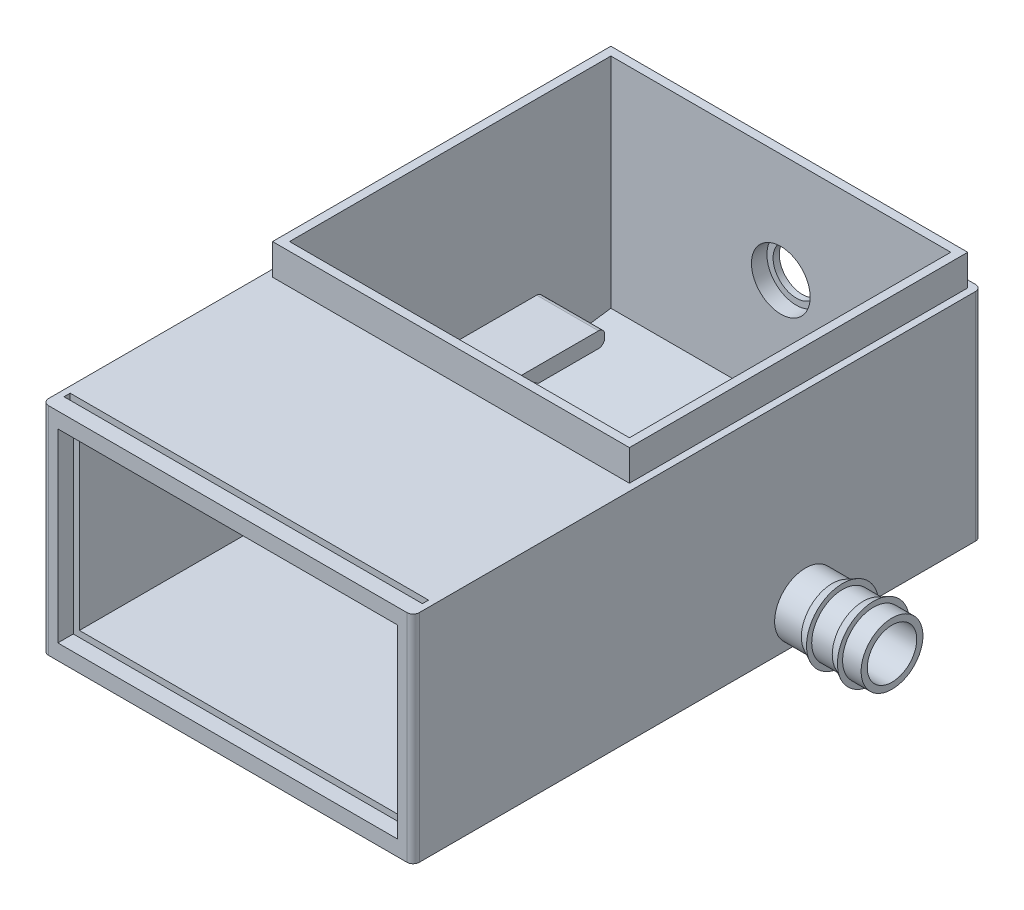
from build123d import *
from build123d.topology import SkipClean

# Parameters (mm, degrees)
CROQUIS2_W                     = 120
CROQUIS2_H                     = 114
SALIENTE_EXTRUIR1_DEPTH        = 10
CORTAR_EXTRUIR1_DEPTH          = 134.225372959
CORTAR_EXTRUIR1_DEPTH_BACK     = 134.225372959
CROQUIS5_W                     = 120
CROQUIS5_H                     = 114
CROQUIS5_W_2                   = 110
CROQUIS5_H_2                   = 104
SALIENTE_EXTRUIR5_DEPTH        = 80
CROQUIS6_R                     = 8
CORTAR_EXTRUIR2_DEPTH          = 10
SALIENTE_EXTRUIR6_START        = 8
CROQUIS7_R                     = 10
CROQUIS7_R_2                   = 8
SALIENTE_EXTRUIR6_DEPTH        = 8
CROQUIS9_R                     = 7.5
CORTAR_EXTRUIR4_DEPTH          = 155.983870128
CROQUIS10_R                    = 9.5
CROQUIS10_R_2                  = 7.5
CORTAR_EXTRUIR5_DEPTH          = 8
SALIENTE_EXTRUIR7_DEPTH        = 20
CROQUIS13_W                    = 120
CROQUIS13_H                    = 114
CROQUIS13_W_2                  = 115.5
CROQUIS13_H_2                  = 109.5
CORTAR_EXTRUIR6_DEPTH          = 10
CROQUIS14_R                    = 1.5
SALIENTE_EXTRUIR8_DEPTH        = 2
CROQUIS15_R                    = 0.75
CORTAR_EXTRUIR7_DEPTH          = 5
CROQUIS16_W                    = 120
CROQUIS16_H                    = 70
CROQUIS16_W_2                  = 110
CROQUIS16_H_2                  = 60
SALIENTE_EXTRUIR9_DEPTH        = 70
CROQUIS17_W                    = 116
CROQUIS17_H                    = 2
CORTAR_EXTRUIR8_DEPTH          = 68
REDONDEO1_R                    = 2
REDONDEO2_R                    = 2
CROQUIS19_R                    = 12.5
CROQUIS19_R_2                  = 7.5
SALIENTE_EXTRUIR11_DEPTH       = 2
CROQUIS21_W                    = 0.990232649
CROQUIS21_H                    = 0.145037793
CORTAR_EXTRUIR9_DEPTH          = 2
SALIENTE_EXTRUIR14_OUTLINE_R   = 10
SALIENTE_EXTRUIR14_OUTLINE_R_2 = 8
SALIENTE_EXTRUIR14_DEPTH       = 10
CROQUIS30_R                    = 10
CROQUIS30_R_2                  = 8
SALIENTE_EXTRUIR15_DEPTH       = 10
CORTAR_EXTRUIR10_DEPTH         = 2


# Read off the part's stored shape, not the designer's step: Recubrir-Lámina1, Saliente-Extruir14, Recubrir-Lámina8
with BuildPart() as part:
    # Croquis2 → Saliente-Extruir1 (new body)
    with BuildSketch(Plane(origin=(0, 0, 0), x_dir=(1, 0, 0), z_dir=(0, 1, 0))):
        Rectangle(CROQUIS2_W, CROQUIS2_H)
    extrude(amount=SALIENTE_EXTRUIR1_DEPTH)

    # Croquis3 → Cortar-Extruir1 (cut, two sides: drawn at the far end of the back side and taken through both)
    with BuildSketch(Plane.ZY.offset(60).offset(-CORTAR_EXTRUIR1_DEPTH_BACK)):
        Polygon((-293.556980837, 43.200979767), (-57, 10), (0, 2), (57, 10), (293.556980837, 43.200979767), (293.556980837, 520.952003796), (-293.556980837, 520.952003796), align=None)
    extrude(amount=CORTAR_EXTRUIR1_DEPTH + CORTAR_EXTRUIR1_DEPTH_BACK, mode=Mode.SUBTRACT)

    # Croquis5 → Saliente-Extruir5 (add)
    with BuildSketch(Plane.XZ):
        Rectangle(CROQUIS5_W, CROQUIS5_H)
        Rectangle(CROQUIS5_W_2, CROQUIS5_H_2, mode=Mode.SUBTRACT)
    extrude(amount=-SALIENTE_EXTRUIR5_DEPTH)

    # Croquis6 → Cortar-Extruir2 (cut)
    with BuildSketch(Plane(origin=(60, 0, 0), x_dir=(0, 0, -1), z_dir=(1, 0, 0))):
        with Locations((0, 10)):
            Circle(CROQUIS6_R)
    extrude(amount=-CORTAR_EXTRUIR2_DEPTH, mode=Mode.SUBTRACT)

    # Croquis7 → Saliente-Extruir6 (add)
    with BuildSketch(Plane(origin=(60, 0, 0), x_dir=(0, 0, -1), z_dir=(1, 0, 0)).offset(SALIENTE_EXTRUIR6_START)):
        with Locations(Location((0, 10, 0), (0, 0, 270))):
            Circle(CROQUIS7_R)
        with Locations((0, 10)):
            Circle(CROQUIS7_R_2, mode=Mode.SUBTRACT)
    extrude(amount=-SALIENTE_EXTRUIR6_DEPTH)

    # Croquis9 → Cortar-Extruir4 (cut, through all)
    with BuildSketch(Plane.XY.offset(57)):
        with Locations((0, 44.649122807)):
            Circle(CROQUIS9_R)
    extrude(amount=-CORTAR_EXTRUIR4_DEPTH, mode=Mode.SUBTRACT)

    # Croquis10 → Cortar-Extruir5 (cut)
    with BuildSketch(Plane.XY.offset(-52)):
        with Locations((0, 44.649122807)):
            Circle(CROQUIS10_R)
        with Locations((0, 44.649122807)):
            Circle(CROQUIS10_R_2, mode=Mode.SUBTRACT)
    cortar_extruir5 = extrude(amount=-CORTAR_EXTRUIR5_DEPTH, mode=Mode.SUBTRACT)

    # Simetría1: Cortar-Extruir5 across plane
    add(cortar_extruir5.mirror(Plane.XY), mode=Mode.SUBTRACT)

    # Croquis11 → Saliente-Extruir7 (add)
    with BuildSketch(Plane.ZY.offset(-55)):
        with BuildLine():
            Line((30, 21.97965363), (30, 22.97965363))
            ThreePointArc((30, 22.97965363), (29.414213562, 24.393867193), (28, 24.97965363))
            Line((28, 24.97965363), (-28, 24.97965363))
            ThreePointArc((-28, 24.97965363), (-29.414213562, 24.393867193), (-30, 22.97965363))
            Line((-30, 22.97965363), (-30, 21.97965363))
            ThreePointArc((-30, 21.97965363), (-29.414213562, 20.565440068), (-28, 19.97965363))
            Line((-28, 19.97965363), (-8.460817995, 19.97965363))
            ThreePointArc((-8.460817995, 19.97965363), (0, 23.083536514), (8.460817995, 19.97965363))
            Line((8.460817995, 19.97965363), (28, 19.97965363))
            ThreePointArc((28, 19.97965363), (29.414213562, 20.565440068), (30, 21.97965363))
        make_face()
    saliente_extruir7 = extrude(amount=SALIENTE_EXTRUIR7_DEPTH)

    # Simetría2: Saliente-Extruir7 across plane
    add(saliente_extruir7.mirror(Plane(origin=(0, 0, 0), x_dir=(0, 0, 1), z_dir=(1, 0, 0))))

    # Croquis13 → Cortar-Extruir6 (cut)
    with BuildSketch(Plane(origin=(0, 80, 0), x_dir=(1, 0, 0), z_dir=(0, 1, 0))):
        Rectangle(CROQUIS13_W, CROQUIS13_H)
        Rectangle(CROQUIS13_W_2, CROQUIS13_H_2, mode=Mode.SUBTRACT)
    extrude(amount=-CORTAR_EXTRUIR6_DEPTH, mode=Mode.SUBTRACT)

    # Croquis14 → Saliente-Extruir8 (add)
    with BuildSketch(Plane.XY.offset(57)):
        with Locations(Location((-45, 60, 0), (0, 0, 180))):
            Circle(CROQUIS14_R)
        with Locations(Location((-45, 10, 0), (0, 0, 180))):
            Circle(CROQUIS14_R)
        with Locations(Location((45, 10, 0), (0, 0, 180))):
            Circle(CROQUIS14_R)
        with Locations(Location((45, 60, 0), (0, 0, 180))):
            Circle(CROQUIS14_R)
    extrude(amount=SALIENTE_EXTRUIR8_DEPTH)

    # Croquis15 → Cortar-Extruir7 (cut)
    with BuildSketch(Plane.XY.offset(59)):
        with Locations((-45, 60)):
            Circle(CROQUIS15_R)
        with Locations((-45, 10)):
            Circle(CROQUIS15_R)
        with Locations((45, 10)):
            Circle(CROQUIS15_R)
        with Locations((45, 60)):
            Circle(CROQUIS15_R)
    extrude(amount=-CORTAR_EXTRUIR7_DEPTH, mode=Mode.SUBTRACT)

    # Croquis16 → Saliente-Extruir9 (add)
    with BuildSketch(Plane.XY.offset(57)):
        with Locations((0, 35)):
            Rectangle(CROQUIS16_W, CROQUIS16_H)
        with Locations((0, 35)):
            Rectangle(CROQUIS16_W_2, CROQUIS16_H_2, mode=Mode.SUBTRACT)
    extrude(amount=SALIENTE_EXTRUIR9_DEPTH)

    # Croquis17 → Cortar-Extruir8 (cut)
    with BuildSketch(Plane(origin=(0, 70, 0), x_dir=(1, 0, 0), z_dir=(0, 1, 0))):
        with Locations((0, -121)):
            Rectangle(CROQUIS17_W, CROQUIS17_H)
    extrude(amount=-CORTAR_EXTRUIR8_DEPTH, mode=Mode.SUBTRACT)

    # Redondeo1
    redondeo1_edges = [part.edges().sort_by_distance(p)[0] for p in [
        (-60, 35, -57),
        (60, 35, -57),
    ]]
    fillet(redondeo1_edges, radius=REDONDEO1_R)

    # Redondeo2
    redondeo2_edges = [part.edges().sort_by_distance(p)[0] for p in [
        (-60, 35, 127),
        (60, 35, 127),
    ]]
    fillet(redondeo2_edges, radius=REDONDEO2_R)

    # Croquis19 → Saliente-Extruir11 (add)
    with BuildSketch(Plane(origin=(0, 0, -57), x_dir=(-1, 0, 0), z_dir=(0, 0, -1))):
        with Locations(Location((0, 44.649122807, 0), (0, 0, 180))):
            Circle(CROQUIS19_R)
        with Locations((0, 44.649122807)):
            Circle(CROQUIS19_R_2, mode=Mode.SUBTRACT)
    saliente_extruir11 = extrude(amount=SALIENTE_EXTRUIR11_DEPTH)

    # Simetría3: Saliente-Extruir11 across plane
    add(saliente_extruir11.mirror(Plane.XY))

    # Croquis21 → Cortar-Extruir9 (cut)
    # profile 1 of 2: a face of its own
    with BuildSketch(Plane(origin=(0, 0, -57), x_dir=(-1, 0, 0), z_dir=(0, 0, -1))):
        Polygon((-30.738084473, 27.587250959), (-32.242943607, 26.052942527), (-33.747557331, 24.518388684), (-33.967445423, 24.518388684), (-33.950512077, 24.743184993), (-33.938486947, 24.907119419), (-33.931370033, 24.959146512), (-33.920817368, 24.995467313), (-33.905111076, 25.01853593), (-33.882042459, 25.031297293), (-33.849893642, 25.036941742), (-33.806455927, 25.038168796), (-33.750011439, 25.037923385), (-33.669025869, 25.039886671), (-33.637122463, 25.042831601), (-33.60939104, 25.047248996), (-33.584113726, 25.053875088), (-33.560308877, 25.062955288), (-33.536504027, 25.074735008), (-33.511717535, 25.089705067), (-33.484476934, 25.108110879), (-33.355881666, 25.241614364), (-33.316125113, 25.321127469), (-33.293056496, 25.40554879), (-33.286921226, 25.49266963), (-33.297473891, 25.57979047), (-33.325450724, 25.663966381), (-33.370851725, 25.742743253), (-33.433676895, 25.81366698), (-33.564726271, 25.900296998), (-33.635895409, 25.925574313), (-33.708782421, 25.938335675), (-33.782160256, 25.938826497), (-33.854556447, 25.927292188), (-33.924743941, 25.903241928), (-33.991004862, 25.867166538), (-34.052112155, 25.818575196), (-34.105120892, 25.767775157), (-34.230771231, 25.881400365), (-34.41065736, 26.01195892), (-34.520110585, 26.072329982), (-34.641343529, 26.12901988), (-34.774110781, 26.181537795), (-34.917185288, 26.229883727), (-35.070567049, 26.273321441), (-35.233274421, 26.31185094), (-35.404571172, 26.345226811), (-35.653417741, 26.386210417), (-35.653417741, 26.548181557), (-37.368348535, 26.548181557), (-37.368348535, 26.490264604), (-37.371293465, 26.461060717), (-37.375465449, 26.450508052), (-37.382336952, 26.442164084), (-37.392153384, 26.435292581), (-37.405650979, 26.430138954), (-37.423075147, 26.425476148), (-37.445162121, 26.421549575), (-37.472402722, 26.417623002), (-37.525656869, 26.410506088), (-37.562959314, 26.405597872), (-37.605906207, 26.399708012), (-37.653025084, 26.393327331), (-37.703579712, 26.386455828), (-37.756343038, 26.379093504), (-37.810088007, 26.37197659), (-37.863587565, 26.364614265), (-37.99709105, 26.34792633), (-38.06605149, 26.341791059), (-38.136975216, 26.336637432), (-38.209616818, 26.33295627), (-38.284221707, 26.330256751), (-38.360789882, 26.328538875), (-38.439566754, 26.328048054), (-38.520552324, 26.328293464), (-38.890141016, 26.335655789), (-38.890141016, 26.101043047), (-39.035178809, 26.021529942), (-39.16745524, 25.935881567), (-39.232734517, 25.885081528), (-39.296050508, 25.830600326), (-39.355685337, 25.773665016), (-39.41065736, 25.715502653), (-39.459248702, 25.657340289), (-39.500477719, 25.600159568), (-39.532626536, 25.545432956), (-39.60281403, 25.412420293), (-39.953015267, 25.412420293), (-39.953015267, 25.074244186), (-39.747606413, 25.074244186), (-39.669074951, 25.072771721), (-39.636435312, 25.071053845), (-39.608458479, 25.068599737), (-39.585144451, 25.065654807), (-39.566493229, 25.061973645), (-39.553241045, 25.057801661), (-39.545142488, 25.052893445), (-39.542442969, 25.047739818), (-39.539988861, 25.012155249), (-39.537043931, 24.977061502), (-39.533362769, 24.931905912), (-39.528699963, 24.878160943), (-39.523300925, 24.817053649), (-39.517411066, 24.750056496), (-39.510784974, 24.678151126), (-39.50366806, 24.603055416), (-39.49164293, 24.452618585), (-39.486489303, 24.382921912), (-39.482071908, 24.318133457), (-39.478390746, 24.260216504), (-39.475691227, 24.210398108), (-39.474218762, 24.169905323), (-39.47372794, 24.139965203), (-39.474709583, 24.122295624), (-39.52158305, 24.139719792), (-39.58784397, 24.198372978), (-39.69263439, 24.300218467), (-39.843071221, 24.452618585), (-40.0467622, 24.662935655), (-40.311315061, 24.938777415), (-40.643846719, 25.287751597), (-41.051964909, 25.716975118), (-41.603648427, 26.298353345), (-41.854949104, 26.563151617), (-42.083181165, 26.80414504), (-42.283927214, 27.015934576), (-42.452033624, 27.193612008), (-42.583083001, 27.332023709), (-42.671921717, 27.426261463), (-42.713886966, 27.471171643), (-42.805670612, 27.572771721), (-42.798308288, 27.364908758), (-42.791191374, 27.157045796), (-41.105219056, 25.378799011), (-39.419246739, 23.600306815), (-39.225863014, 21.372467412), (-39.035178809, 19.144628008), (-39.090641654, 19.086465645), (-39.217273636, 18.955416268), (-39.35347664, 18.815777513), (-39.531154072, 18.634173508), (-39.745643126, 18.415267058), (-39.991299355, 18.164457203), (-40.263459952, 17.886897568), (-40.556725879, 17.58749637), (-40.865943509, 17.271898059), (-41.464009672, 16.661070533), (-41.731507463, 16.387192061), (-41.971764654, 16.141045011), (-42.179136795, 15.92778301), (-42.349206491, 15.752559686), (-42.476574706, 15.620283255), (-42.556333221, 15.536352756), (-42.583328411, 15.505676403), (-42.576702319, 15.49561456), (-42.568849173, 15.487516003), (-42.558541919, 15.477208749), (-42.546025967, 15.465429029), (-42.53179214, 15.452176845), (-42.516085847, 15.437697607), (-42.499397912, 15.422482136), (-42.481973744, 15.406530433), (-42.380619076, 15.319655004), (-40.70421778, 17.032622511), (-40.119158391, 17.626762101), (-39.856814227, 17.891805784), (-39.62072902, 18.129118045), (-39.416301809, 18.333545256), (-39.248195399, 18.500670023), (-39.121318006, 18.625093307), (-39.040577847, 18.701906893), (-39.010883138, 18.726447975), (-39.000821295, 18.670003487), (-38.99345897, 18.608650783), (-38.984624181, 18.528401445), (-38.974807748, 18.431464172), (-38.964009672, 18.320047661), (-38.952720774, 18.19660602), (-38.940941055, 18.063102535), (-38.928915925, 17.921991315), (-38.866090756, 17.136676698), (-38.793449154, 17.07139742), (-38.755165066, 17.033358744), (-38.742649114, 17.014952932), (-38.733568914, 16.99335678), (-38.727433644, 16.965870769), (-38.723752481, 16.930531611), (-38.721789195, 16.884394377), (-38.721298373, 16.825004959), (-38.721052962, 16.749909249), (-38.721052962, 16.496399875), (-38.06899642, 16.496399875), (-38.06899642, 17.027959706), (-35.655871849, 17.027959706), (-35.583475658, 16.923905519), (-35.511570288, 16.830649408), (-35.472059147, 16.788438748), (-35.429848486, 16.748927606), (-35.384692896, 16.711870573), (-35.336592375, 16.677022236), (-35.284810693, 16.644137187), (-35.229593259, 16.612970013), (-35.170449252, 16.583275304), (-35.087009574, 16.545482038), (-35.051670416, 16.532720676), (-35.016576669, 16.523149654), (-34.979765046, 16.516523562), (-34.938045207, 16.512106167), (-34.889453865, 16.509652059), (-34.83080068, 16.508670415), (-34.759631543, 16.508425005), (-34.629072988, 16.509652059), (-34.580236235, 16.512351578), (-34.538761807, 16.516768972), (-34.501950184, 16.523640475), (-34.467347259, 16.533456908), (-34.432008101, 16.546709092), (-34.393478603, 16.563887849), (-34.349059245, 16.585729412), (-34.193714197, 16.678494701), (-34.123035882, 16.733712135), (-34.057756604, 16.793837786), (-33.998121776, 16.858871652), (-33.944867628, 16.928322914), (-33.897748751, 17.001700748), (-33.857746788, 17.078514334), (-33.824861738, 17.15827285), (-33.811854965, 17.203673851), (-33.805474284, 17.232632328), (-33.799093602, 17.264535734), (-33.792958332, 17.298402427), (-33.787313883, 17.333741585), (-33.782405667, 17.369326153), (-33.777988272, 17.404665311), (-33.77430711, 17.438532004), (-33.757373763, 17.622344706), (-32.766895703, 16.57591298), (-32.416203645, 16.206324288), (-32.255214148, 16.036745413), (-32.107722247, 15.881645776), (-31.977163692, 15.744461129), (-31.866728824, 15.628381812), (-31.778871751, 15.536843577), (-31.717273636, 15.473036765), (-31.684879408, 15.440397126), (-31.59554987, 15.351067588), (-31.4964039, 15.44751404), (-31.399957448, 15.54666001), (-32.829720872, 17.054464074), (-33.334285514, 17.586760138), (-33.565707915, 17.83069849), (-33.77725204, 18.053531513), (-33.964500493, 18.25084181), (-34.122790471, 18.417475756), (-34.247949988, 18.549015954), (-34.335316239, 18.6407996), (-34.380471829, 18.687918477), (-34.50366806, 18.813568815), (-34.303167422, 20.959195595), (-34.23347075, 21.712606805), (-34.201321933, 22.055200306), (-34.172363456, 22.366135813), (-34.14659532, 22.639032642), (-34.124753757, 22.867510113), (-34.107820411, 23.044942134), (-34.096286103, 23.164948024), (-34.090641654, 23.220901691), (-34.076162416, 23.334526899), (-33.286430404, 23.334526899), (-33.286430404, 23.924003683), (-33.287412047, 24.18119422), (-33.288884512, 24.278622315), (-33.291338621, 24.357644598), (-33.29428355, 24.419488124), (-33.298210123, 24.465870769), (-33.302872929, 24.498019586), (-33.308517378, 24.517407041), (-33.315388881, 24.525751008), (-33.250109603, 24.605754935), (-33.165442871, 24.698274813), (-33.050345198, 24.820734811), (-32.908497745, 24.969699178), (-32.742845443, 25.141732161), (-32.557314865, 25.333398009), (-32.35485094, 25.54077015), (-32.138889421, 25.760412832), (-31.712365419, 26.195771623), (-31.516527587, 26.395536028), (-31.337868512, 26.578612499), (-31.179578534, 26.74107446), (-31.045584228, 26.878749929), (-30.939812165, 26.988203153), (-30.865698098, 27.06526215), (-30.827414011, 27.106245757), (-30.723605235, 27.222325073), (-30.730722149, 27.403438257), align=None)
        Polygon((-34.583181165, 17.963220332), (-34.547105775, 17.948495683), (-34.393233192, 17.834625064), (-34.336788704, 17.76468298), (-34.294578043, 17.687623984), (-34.267337443, 17.605165949), (-34.255066902, 17.51853593), (-34.258748064, 17.429206393), (-34.27862634, 17.33840439), (-34.315192552, 17.247847798), (-34.379981008, 17.144775255), (-34.416792631, 17.103791648), (-34.457285415, 17.069434134), (-34.502195595, 17.04121189), (-34.552013991, 17.018879505), (-34.607231425, 17.00219157), (-34.668093308, 16.990902672), (-34.735581283, 16.98427658), (-34.80994076, 16.981822472), (-34.841107934, 16.982558704), (-34.869330178, 16.984767402), (-34.895343725, 16.988693975), (-34.919884807, 16.994338424), (-34.943689656, 17.001700748), (-34.967249095, 17.01127177), (-34.991544766, 17.023051489), (-35.194744923, 17.205146316), (-35.249962357, 17.321716455), (-35.274503438, 17.44638515), (-35.26885899, 17.573017132), (-35.233274421, 17.694986308), (-35.168240554, 17.805666587), (-35.0740028, 17.898922698), (-34.950561159, 17.967883138), (-34.869821, 17.987516003), (-34.822456712, 17.991687987), (-34.772392905, 17.99266963), (-34.721838277, 17.989970111), (-34.672265292, 17.984080252), (-34.625391826, 17.975245462), align=None, mode=Mode.SUBTRACT)
        Polygon((-36.041657655, 20.03350599), (-35.861280704, 19.842821785), (-35.302725682, 19.252363357), (-35.123575786, 19.058488811), (-34.998661679, 18.916395948), (-34.919148574, 18.814059637), (-34.87595627, 18.740190981), (-34.859513746, 18.682519439), (-34.8607408, 18.629510702), (-34.870802643, 18.569385052), (-34.880864487, 18.522511586), (-34.887981401, 18.505578239), (-34.898043244, 18.492080644), (-34.912031661, 18.480791747), (-34.930928294, 18.470729903), (-34.956205608, 18.461158881), (-34.989090657, 18.450851627), (-35.030319675, 18.439071908), (-35.283338228, 18.329127861), (-35.392791453, 18.251578043), (-35.489483315, 18.161021451), (-35.572432171, 18.058194318), (-35.640410968, 17.945059932), (-35.692683472, 17.822354523), (-35.727777219, 17.691795968), (-35.745201387, 17.554611321), (-35.757226517, 17.366135813), (-38.527914649, 17.366135813), (-38.537485671, 17.421844068), (-38.560554288, 17.639523463), (-38.578960099, 17.844686907), (-38.599820018, 18.084453276), (-38.62117076, 18.336735597), (-38.641049036, 18.578956074), (-38.657491561, 18.789518555), (-38.668535047, 18.946090657), (-38.672707031, 19.026094584), (-38.651601701, 19.084502358), (-38.617735008, 19.131866646), (-38.562026752, 19.198372978), (-38.479568718, 19.289665802), (-38.365452687, 19.410898746), (-38.214525035, 19.567716258), (-38.022368364, 19.765517377), (-37.783829049, 20.009701141), (-37.474366008, 20.324317809), (-37.334972664, 20.464938208), (-37.209813147, 20.591079368), (-37.101096155, 20.700041771), (-37.011275795, 20.788880487), (-36.943296999, 20.855386819), (-36.899613873, 20.897106658), (-36.882925938, 20.910849664), (-36.813720087, 20.842625456), (-36.73666109, 20.76286694), (-36.635061012, 20.657094878), (-36.51161937, 20.528008788), (-36.369771918, 20.379044422), (-36.212218173, 20.213146709), align=None, mode=Mode.SUBTRACT)
        Polygon((-38.14703706, 22.255700945), (-37.832174981, 21.923414697), (-37.080972468, 21.128283648), (-37.89500015, 20.297077208), (-38.178204234, 20.008228676), (-38.305327037, 19.879878818), (-38.419688478, 19.765762788), (-38.518589038, 19.667843872), (-38.599820018, 19.588330767), (-38.660927312, 19.529922992), (-38.699947632, 19.494829245), (-38.713936049, 19.485258223), (-38.75639212, 19.953011242), (-38.799339013, 20.440397126), (-38.849893642, 21.017603369), (-38.902656967, 21.625485965), (-38.952966185, 22.204655494), (-38.995176846, 22.695967952), (-39.024135322, 23.039788507), (-39.035178809, 23.177463976), (-39.003029992, 23.151450429), (-38.953947828, 23.102613676), (-38.875416367, 23.021628107), (-38.761300336, 22.90260386), (-38.605709878, 22.739160255), (-38.403000543, 22.525652844), align=None, mode=Mode.SUBTRACT)
        Polygon((-38.890386427, 25.583471633), (-38.890141016, 25.557458086), (-38.890141016, 25.412420293), (-39.047203939, 25.412420293), (-39.102175962, 25.413647347), (-39.126471633, 25.414874401), (-39.148558607, 25.416592277), (-39.16745524, 25.418800974), (-39.182916121, 25.421500493), (-39.19445043, 25.424445423), (-39.201567343, 25.427881174), (-39.204266862, 25.431807747), (-39.173835921, 25.485798127), (-39.141196282, 25.523591393), (-39.100948908, 25.564084178), (-39.056774961, 25.604331552), (-39.012110192, 25.641388586), (-38.969899531, 25.672310349), (-38.933824141, 25.69366109), (-38.907074362, 25.702495879), (-38.900939092, 25.693415679), (-38.898484984, 25.682617603), (-38.896030875, 25.668383776), (-38.894067589, 25.650714197), (-38.892349713, 25.63059051), (-38.891122659, 25.608012714), align=None, mode=Mode.SUBTRACT)
        Polygon((-34.439615837, 23.27759159), (-34.443296999, 23.213539366), (-34.492379162, 22.665782421), (-34.541461326, 22.132013892), (-34.599132868, 21.507443361), (-34.659503929, 20.854159765), (-34.717175471, 20.234252039), (-34.766257635, 19.7093183), (-34.80086056, 19.341692895), (-34.815339798, 19.19297394), (-34.859268335, 19.219478308), (-34.914240358, 19.269542115), (-34.992280998, 19.345128647), (-35.093635666, 19.446728725), (-35.219531415, 19.575323994), (-35.370459068, 19.731650684), (-35.546909446, 19.91644503), (-35.750109603, 20.130443263), (-36.073561061, 20.473527586), (-36.218108033, 20.627400169), (-36.347439533, 20.76581187), (-36.459101455, 20.886063171), (-36.550148869, 20.98496373), (-36.618373076, 21.05981403), (-36.661074558, 21.107669139), (-36.675308386, 21.126074951), (-36.605120892, 21.20092525), (-36.52339909, 21.286082804), (-36.414682097, 21.398726369), (-36.282160256, 21.535420195), (-36.129023906, 21.69321935), (-35.958217977, 21.868442674), (-35.772932809, 22.058390647), (-35.576113333, 22.259136696), (-34.965531219, 22.879535243), (-34.765521402, 23.078563416), (-34.622937717, 23.213784777), (-34.528699963, 23.293543293), (-34.472991708, 23.325446699), (-34.446487339, 23.317593553), align=None, mode=Mode.SUBTRACT)
        Polygon((-34.271754837, 25.049948515), (-34.288688184, 24.827851725), (-34.301449546, 24.668825515), (-34.307830227, 24.615571368), (-34.315437963, 24.576551048), (-34.324763574, 24.549555858), (-34.337279526, 24.532622511), (-34.353231229, 24.5232969), (-34.373845737, 24.519370327), (-34.399859284, 24.518388684), (-34.469801367, 24.518388684), (-34.469801367, 23.781419998), (-35.291191374, 22.960029991), (-35.291191374, 23.334526899), (-37.416694466, 23.334526899), (-37.416694466, 22.657929275), (-36.50842903, 22.657929275), (-36.187186269, 22.65645681), (-36.045829638, 22.654984345), (-35.920424711, 22.652775648), (-35.813425594, 22.650076129), (-35.726550165, 22.647131199), (-35.66225253, 22.643695447), (-35.622495978, 22.640014285), (-35.609980026, 22.636087712), (-35.651699865, 22.588232603), (-35.699554975, 22.537432563), (-35.763116376, 22.470926232), (-35.840420784, 22.390922305), (-35.9292595, 22.299138659), (-36.02816006, 22.19729317), (-36.134913765, 22.087594534), (-36.247557331, 21.971760628), (-36.880471829, 21.331238394), (-37.107476836, 21.565605725), (-37.230673066, 21.69321935), (-37.317793907, 21.784266764), (-37.418657753, 21.889793415), (-37.530319675, 22.007099786), (-37.650080154, 22.133240947), (-37.775485082, 22.265517377), (-37.903834939, 22.400984149), (-38.032675619, 22.537187152), (-38.286430404, 22.805175765), (-38.407908759, 22.933525623), (-38.522515611, 23.054513156), (-38.627796852, 23.165193435), (-38.721052962, 23.263357762), (-38.799829835, 23.346306618), (-38.861918772, 23.411095074), (-38.904620254, 23.455269022), (-39.078616524, 23.636627616), (-39.129416563, 24.288929569), (-39.148313196, 24.519861149), (-39.157393396, 24.6253878), (-39.165982775, 24.722079663), (-39.173835921, 24.807237216), (-39.180952835, 24.879387997), (-39.186597284, 24.936323306), (-39.191260089, 24.97632527), (-39.19445043, 24.996939778), (-39.204266862, 25.049948515), align=None, mode=Mode.SUBTRACT)
        Polygon((-33.600556251, 23.981675226), (-33.60031084, 23.914432661), (-33.60031084, 23.621902967), (-33.822653041, 23.629265291), (-34.047203939, 23.636627616), (-34.039841615, 23.733074067), (-34.031006825, 23.784610339), (-34.022172036, 23.808660599), (-34.008919851, 23.833692502), (-33.99051404, 23.860687692), (-33.965972958, 23.891118634), (-33.934560374, 23.926703202), (-33.895049232, 23.968668452), (-33.846703301, 24.018241437), (-33.780687791, 24.082784482), (-33.749520617, 24.111742959), (-33.720807551, 24.137756506), (-33.695039416, 24.16008889), (-33.67246162, 24.178740112), (-33.654055809, 24.192483118), (-33.640312803, 24.201317907), (-33.631723425, 24.204262837), (-33.617980419, 24.192728529), (-33.612826792, 24.177513058), (-33.608654808, 24.154935263), (-33.605464467, 24.124749732), (-33.603010359, 24.086220234), (-33.601537894, 24.038610535), align=None, mode=Mode.SUBTRACT)
        Polygon((-37.370802643, 26.064967657), (-37.36368573, 25.890971387), (-37.356323405, 25.714521009), (-35.665442871, 25.714521009), (-35.653417741, 25.874038041), (-35.641392611, 26.031100964), (-35.448254297, 25.99968838), (-35.253152697, 25.96091347), (-35.155970013, 25.937108621), (-35.060996027, 25.911095074), (-34.969212381, 25.883118241), (-34.882091541, 25.853668943), (-34.800615149, 25.822992591), (-34.726501082, 25.791825417), (-34.660730983, 25.760412832), (-34.552995634, 25.693170268), (-34.498759844, 25.652922894), (-34.446978161, 25.610712233), (-34.400104695, 25.568501573), (-34.359857321, 25.528254199), (-34.328444736, 25.491442576), (-34.308075638, 25.460275402), (-34.300713314, 25.436715964), (-34.397895998, 25.426899531), (-34.519619763, 25.422972958), (-34.690425692, 25.419537206), (-34.910804607, 25.417083098), (-35.181001917, 25.415119812), (-35.501508445, 25.413647347), (-35.87207878, 25.412665704), (-36.293449154, 25.412420293), (-38.286430404, 25.412420293), (-38.286430404, 25.939317318), (-38.061634095, 25.980300925), (-37.897208847, 26.007786937), (-37.817695742, 26.019812067), (-37.741618389, 26.030855553), (-37.669713019, 26.040671986), (-37.603452098, 26.048770543), (-37.543571859, 26.055151224), (-37.491544766, 26.05981403), (-37.448107051, 26.062513549), align=None, mode=Mode.SUBTRACT)
        with Locations((-36.511005844, 26.137486554)):
            Rectangle(CROQUIS21_W, CROQUIS21_H, mode=Mode.SUBTRACT)
    # profile 2 of 2: a face of its own
    with BuildSketch(Plane(origin=(0, 0, -57), x_dir=(-1, 0, 0), z_dir=(0, 0, -1))):
        Polygon((-34.822211301, 17.813028912), (-34.904669336, 17.784070435), (-35.032528372, 17.675844264), (-35.070076227, 17.607865468), (-35.090199914, 17.534487633), (-35.092654022, 17.459146512), (-35.077438552, 17.384787035), (-35.044062681, 17.314108719), (-34.99301723, 17.250547317), (-34.924056791, 17.197047759), (-34.795952344, 17.153364634), (-34.730673066, 17.152873812), (-34.667111665, 17.165635174), (-34.607231425, 17.190912489), (-34.552995634, 17.227478701), (-34.506122168, 17.274597578), (-34.469065135, 17.331778298), (-34.443296999, 17.397548397), (-34.444278642, 17.570072202), (-34.476427459, 17.645904145), (-34.525509623, 17.711428833), (-34.588089381, 17.763701337), (-34.660485573, 17.800022138), (-34.739753267, 17.817200895), align=None)
    extrude(amount=-CORTAR_EXTRUIR9_DEPTH, mode=Mode.SUBTRACT)



with BuildPart() as body_2:
    # Recubrir-Lámina1 outline → Recubrir-Lámina1 (revolve)
    with BuildSketch(Plane(origin=(0, 10, 0), x_dir=(0, 1, 0), z_dir=(0, 0, -1))):
        Polygon((10, 72), (8, 68), (9.677050983, 68), (11.677050983, 72), align=None)
    revolve(axis=Axis((0, 10, 0), (1, 0, 0)))


with BuildPart() as part_1:
    with SkipClean():  # the faces are left unmerged after this step: merging them gives an invalid solid
        add(part.part)

        add(body_2.part)  # Saliente-Extruir14 merges body 2
        # Saliente-Extruir14 outline → Saliente-Extruir14 (add)
        with BuildSketch(Plane(origin=(68, 0, 0), x_dir=(0, 0, -1), z_dir=(1, 0, 0))):
            with Locations((0, 10)):
                Circle(SALIENTE_EXTRUIR14_OUTLINE_R)
            with Locations((0, 10)):
                Circle(SALIENTE_EXTRUIR14_OUTLINE_R_2, mode=Mode.SUBTRACT)
        extrude(amount=SALIENTE_EXTRUIR14_DEPTH)

    # Recubrir-Lámina8 outline → Recubrir-Lámina8 (revolve)
    with SkipClean():  # the faces are left unmerged after this step: merging them gives an invalid solid
        with BuildSketch(Plane(origin=(0, 10, 0), x_dir=(0, 1, 0), z_dir=(0, 0, -1))):
            Polygon((11.677050983, 82), (10, 82), (8, 78), (9.677050983, 78), align=None)
        revolve(axis=Axis((0, 10, 0), (1, 0, 0)))

    # Croquis30 → Saliente-Extruir15 (add)
    with SkipClean():  # the faces are left unmerged after this step: merging them gives an invalid solid
        with BuildSketch(Plane(origin=(78, 0, 0), x_dir=(0, 0, -1), z_dir=(1, 0, 0))):
            with Locations(Location((0, 10, 0), (0, 0, 180))):
                Circle(CROQUIS30_R)
            with Locations((0, 10)):
                Circle(CROQUIS30_R_2, mode=Mode.SUBTRACT)
        extrude(amount=SALIENTE_EXTRUIR15_DEPTH)

    # Croquis32 → Cortar-Extruir10 (cut)
    # profile 1 of 9: a face of its own
    with SkipClean():  # the faces are left unmerged after this step: merging them gives an invalid solid
        with BuildSketch(Plane(origin=(0, 0, -57), x_dir=(-1, 0, 0), z_dir=(0, 0, -1))):
            with BuildLine():
                add(Edge.make_bspline(
                    [(13.593499923, 23.317502333), (13.64035921, 23.316049547), (13.732709015, 23.313186411), (13.867735378, 23.287870508), (13.997487195, 23.249524012), (14.120165639, 23.191855834), (14.238583967, 23.121220541), (14.348702782, 23.031228621), (14.454554498, 22.927789978), (14.553429627, 22.808477904), (14.64411177, 22.674176167), (14.721857228, 22.523561083), (14.789230067, 22.359186108), (14.842707756, 22.17986728), (14.884867133, 21.986347221), (14.914144352, 21.778103481), (14.932471498, 21.555345123), (14.934568404, 21.40214181), (14.935647359, 21.323311628)],
                    knots=[0, 0, 0, 0, 0.836471817, 1.648510141, 2.446693269, 3.247435573, 4.063800371, 4.904091908, 5.781463953, 6.704836402, 7.667709944, 8.670923685, 9.727683881, 10.837250621, 12.009625467, 13.263198326, 14.591789123, 16, 16, 16, 16], degree=3))
                add(Edge.make_bspline(
                    [(14.935647359, 21.323311628), (14.934621969, 21.24082758), (14.93259876, 21.078077288), (14.918448909, 20.837115391), (14.894599197, 20.602824907), (14.860710793, 20.375161407), (14.816386045, 20.154672284), (14.763539471, 19.940584456), (14.700366095, 19.733404785), (14.628484798, 19.533978071), (14.550261673, 19.344967066), (14.465928384, 19.168771346), (14.376684893, 19.006997261), (14.285181407, 18.857285139), (14.186620739, 18.723530449), (14.085206191, 18.602158008), (13.979498429, 18.494269437), (13.867313539, 18.402178052), (13.753058098, 18.322130443), (13.637037976, 18.252248489), (13.51894355, 18.193028012), (13.398375301, 18.144593935), (13.275877563, 18.10780712), (13.151791258, 18.080201847), (13.025370178, 18.0637673), (12.940168367, 18.061986345), (12.897386141, 18.061092077)],
                    knots=[0, 0, 0, 0, 1.396844559, 2.756131219, 4.086127259, 5.383920942, 6.652453196, 7.89349539, 9.116895717, 10.318757433, 11.482194025, 12.579741648, 13.624829685, 14.610133714, 15.548779577, 16.435605836, 17.287197802, 18.102347136, 18.889788549, 19.648068299, 20.394000194, 21.124756219, 21.84557971, 22.557590164, 23.275725456, 24, 24, 24, 24], degree=3))
                add(Edge.make_bspline(
                    [(12.897386141, 18.061092077), (12.837408451, 18.063534891), (12.719868412, 18.068322144), (12.548436641, 18.108028157), (12.387164749, 18.17226998), (12.262233493, 18.247155358), (12.168769088, 18.318931512), (12.102342058, 18.380434137), (12.037332773, 18.446063572), (11.978310926, 18.520238086), (11.922760413, 18.600245057), (11.868922494, 18.68560209), (11.820243139, 18.777890595), (11.775060438, 18.876501335), (11.733404688, 18.981798691), (11.698974085, 19.095538899), (11.668474139, 19.216762044), (11.645575381, 19.346126098), (11.624388964, 19.48252028), (11.612486515, 19.627098499), (11.604109857, 19.77907467), (11.602921315, 19.88299413), (11.602314026, 19.936092077)],
                    knots=[0, 0, 0, 0, 1.406247179, 2.755863859, 4.106117258, 5.46602111, 6.158742467, 6.868709005, 7.589063128, 8.324514997, 9.089670002, 9.87455016, 10.69128516, 11.536247762, 12.419471489, 13.346380782, 14.323181077, 15.351303999, 16.428392134, 17.561291642, 18.753934945, 20, 20, 20, 20], degree=3))
                add(Edge.make_bspline(
                    [(11.602314026, 19.936092077), (11.603343251, 20.025919803), (11.605376176, 20.203347415), (11.619473985, 20.465656075), (11.64322213, 20.720319948), (11.677576424, 20.966841937), (11.720066862, 21.2056445), (11.773658706, 21.436065381), (11.834896469, 21.659416941), (11.884973418, 21.8036641), (11.909806013, 21.875194641)],
                    knots=[0, 0, 0, 0, 1.092573637, 2.158050095, 3.194115651, 4.202596009, 5.184740479, 6.143227219, 7.07924729, 8, 8, 8, 8], degree=3))
                add(Edge.make_bspline(
                    [(11.909806013, 21.875194641), (11.933142603, 21.935585106), (11.978775535, 22.053674077), (12.057483549, 22.221858335), (12.140098004, 22.37836653), (12.228272254, 22.522014704), (12.32165744, 22.653154373), (12.420702334, 22.77146482), (12.525357506, 22.877584609), (12.635467647, 22.970474567), (12.749323567, 23.051459606), (12.864075779, 23.123401617), (12.98219951, 23.182328332), (13.101188465, 23.231743538), (13.221815309, 23.270118114), (13.344196779, 23.296977669), (13.468088343, 23.315132966), (13.551702738, 23.31671267), (13.593499923, 23.317502333)],
                    knots=[0, 0, 0, 0, 1.312439913, 2.566376662, 3.7626465, 4.899353607, 5.981447343, 7.024199363, 8.024692673, 8.999854102, 9.941079975, 10.856034809, 11.7431154, 12.614348406, 13.466487218, 14.305782657, 15.153094213, 16, 16, 16, 16], degree=3))
            make_face()
            with BuildLine():
                add(Edge.make_bspline(
                    [(13.500350885, 22.484169), (13.46767955, 22.482032948), (13.401666674, 22.477717026), (13.305733445, 22.442212408), (13.213593498, 22.385940335), (13.159902994, 22.334729227), (13.131761141, 22.307886949)],
                    knots=[0, 0, 0, 0, 0.932167559, 1.883457255, 2.89061511, 4, 4, 4, 4], degree=3))
                add(Edge.make_bspline(
                    [(13.131761141, 22.307886949), (13.110832672, 22.284285992), (13.066774234, 22.234601455), (13.009227014, 22.147285088), (12.950050044, 22.049209821), (12.896032048, 21.93615707), (12.842014638, 21.810841863), (12.788410428, 21.672546268), (12.739587513, 21.520206585), (12.673297703, 21.300880728), (12.603826674, 21.014286436), (12.54371109, 20.661265204), (12.506591721, 20.30147295), (12.502039712, 20.059042829), (12.499749923, 19.937093679)],
                    knots=[0, 0, 0, 0, 0.454841493, 0.957528522, 1.506411314, 2.107825232, 2.764136245, 3.476658851, 4.247912131, 5.07291354, 6.784378205, 8.500722671, 10.239765365, 12, 12, 12, 12], degree=3))
                add(Edge.make_bspline(
                    [(12.499749923, 19.937093679), (12.500147232, 19.888346552), (12.500909525, 19.794818283), (12.506284108, 19.660766307), (12.518008284, 19.538936612), (12.530859513, 19.42905489), (12.549848584, 19.331677604), (12.572911901, 19.246634895), (12.599043575, 19.17337946), (12.630852118, 19.111724275), (12.666086716, 19.060060372), (12.705236, 19.016156786), (12.746398649, 18.978166317), (12.791776849, 18.947533814), (12.839342828, 18.923092519), (12.891049751, 18.907641076), (12.944895429, 18.895441428), (12.982447224, 18.894768024), (13.001552808, 18.89442541)],
                    knots=[0, 0, 0, 0, 1.809169144, 3.47114723, 4.976568932, 6.350508084, 7.575216927, 8.654321082, 9.618705548, 10.455493865, 11.22189838, 11.932917759, 12.63470061, 13.29454068, 13.959479695, 14.609946561, 15.292769288, 16, 16, 16, 16], degree=3))
                add(Edge.make_bspline(
                    [(13.001552808, 18.89442541), (13.037656238, 18.897300188), (13.11252865, 18.903261992), (13.223440217, 18.949509592), (13.333563154, 19.022526928), (13.424780583, 19.103142079), (13.497940051, 19.184190792), (13.55129946, 19.262348469), (13.604344813, 19.353261048), (13.657567192, 19.456819588), (13.706870809, 19.575313557), (13.757175616, 19.706396411), (13.8059527, 19.851417057), (13.869051823, 20.064547093), (13.938529331, 20.347368948), (13.995429951, 20.703107729), (14.031437259, 21.074170986), (14.035926632, 21.326899182), (14.038211462, 21.455523167)],
                    knots=[0, 0, 0, 0, 0.585084729, 1.213366824, 1.923217654, 2.726038827, 3.183054462, 3.692969635, 4.259263019, 4.892137045, 5.581993971, 6.3422359, 7.172083011, 8.065836625, 9.951587279, 11.896519821, 13.911566738, 16, 16, 16, 16], degree=3))
                add(Edge.make_bspline(
                    [(14.038211462, 21.455523167), (14.037909868, 21.499934376), (14.037326675, 21.58581276), (14.030563984, 21.709521405), (14.018096462, 21.823379027), (14.003357488, 21.927764894), (13.980342873, 22.021670095), (13.956607531, 22.106817112), (13.925171846, 22.181021785), (13.889979395, 22.246192082), (13.85067021, 22.30206093), (13.809769465, 22.351117092), (13.764719521, 22.391415919), (13.717985664, 22.4260415), (13.66730244, 22.452467502), (13.613785337, 22.470192245), (13.557935227, 22.481803188), (13.519773795, 22.483371023), (13.500350885, 22.484169)],
                    knots=[0, 0, 0, 0, 1.651300251, 3.193135231, 4.60384893, 5.910135154, 7.108621979, 8.196635245, 9.19265296, 10.098222774, 10.945408105, 11.729089381, 12.467301952, 13.187443458, 13.887068836, 14.581941946, 15.278255209, 16, 16, 16, 16], degree=3))
            make_face(mode=Mode.SUBTRACT)
        # profile 2 of 9: a face of its own
        with BuildSketch(Plane(origin=(0, 0, -57), x_dir=(-1, 0, 0), z_dir=(0, 0, -1))):
            with BuildLine():
                add(Edge.make_bspline(
                    [(9.038211462, 23.381604897), (9.076460725, 23.379374499), (9.151593504, 23.374993342), (9.260546452, 23.343519023), (9.358903782, 23.287222883), (9.44743155, 23.213901909), (9.520752524, 23.125374141), (9.577048664, 23.027016811), (9.608522983, 22.918063863), (9.61290414, 22.842931083), (9.615134538, 22.804681821)],
                    knots=[0, 0, 0, 0, 1.014134371, 1.992057583, 2.975098753, 4, 5.024901247, 6.007942417, 6.985865629, 8, 8, 8, 8], degree=3))
                add(Edge.make_bspline(
                    [(9.615134538, 22.804681821), (9.612919348, 22.766423915), (9.608568064, 22.691274159), (9.576792936, 22.582161914), (9.521098374, 22.483112466), (9.447345787, 22.394564714), (9.359206321, 22.320934345), (9.260239542, 22.266067249), (9.151632693, 22.234300455), (9.076473945, 22.22996558), (9.038211462, 22.227758744)],
                    knots=[0, 0, 0, 0, 1.013694729, 1.991193998, 2.981551723, 4.006008661, 5.030465598, 6.008806002, 6.986305271, 8, 8, 8, 8], degree=3))
                add(Edge.make_bspline(
                    [(9.038211462, 22.227758744), (8.999940536, 22.229950486), (8.924765205, 22.234255712), (8.815995274, 22.266322608), (8.716342844, 22.320588798), (8.628178966, 22.394649325), (8.554118439, 22.482813203), (8.499852249, 22.582465632), (8.467785353, 22.691235564), (8.463480127, 22.766410895), (8.461288385, 22.804681821)],
                    knots=[0, 0, 0, 0, 1.01324697, 1.990314468, 2.975995575, 4, 5.024004425, 6.009685532, 6.98675303, 8, 8, 8, 8], degree=3))
                add(Edge.make_bspline(
                    [(8.461288385, 22.804681821), (8.463495221, 22.842944304), (8.467830096, 22.918103051), (8.49959689, 23.026709901), (8.554463986, 23.12567668), (8.628094355, 23.213816146), (8.716642107, 23.287568733), (8.815691555, 23.343263295), (8.9248038, 23.375038423), (8.999953556, 23.379389707), (9.038211462, 23.381604897)],
                    knots=[0, 0, 0, 0, 1.013694729, 1.991193998, 2.969534402, 3.993991339, 5.018448277, 6.008806002, 6.986305271, 8, 8, 8, 8], degree=3))
            make_face()
        # profile 3 of 9: a face of its own
        with BuildSketch(Plane(origin=(0, 0, -57), x_dir=(-1, 0, 0), z_dir=(0, 0, -1))):
            Polygon((8.403195436, 21.843143359), (9.308644154, 21.843143359), (8.789814026, 18.189297205), (7.884365308, 18.189297205), align=None)
        # profile 4 of 9: a face of its own
        with BuildSketch(Plane(origin=(0, 0, -57), x_dir=(-1, 0, 0), z_dir=(0, 0, -1))):
            with BuildLine():
                Line((4.300631333, 21.843143359), (5.206080051, 21.843143359))
                Line((5.206080051, 21.843143359), (5.148988705, 21.439497526))
                add(Edge.make_bspline(
                    [(5.148988705, 21.439497526), (5.192525798, 21.476565924), (5.277630786, 21.549026105), (5.411533687, 21.644002164), (5.545547554, 21.726535793), (5.682418949, 21.791095289), (5.819836283, 21.843412264), (5.958768128, 21.880170756), (6.099389372, 21.903480029), (6.193570744, 21.905989309), (6.2407355, 21.907245923)],
                    knots=[0, 0, 0, 0, 1.129074261, 2.207080079, 3.239806547, 4.233987332, 5.191979582, 6.140686111, 7.068880775, 8, 8, 8, 8], degree=3))
                add(Edge.make_bspline(
                    [(6.2407355, 21.907245923), (6.280159431, 21.906125039), (6.357551732, 21.903924656), (6.471007549, 21.891351806), (6.57853834, 21.86800584), (6.680819801, 21.836212015), (6.776866383, 21.793355622), (6.86897638, 21.74384384), (6.954234771, 21.682735052), (7.034099042, 21.61438247), (7.105525305, 21.538275804), (7.169563863, 21.458157925), (7.222708105, 21.372154708), (7.267256455, 21.28178983), (7.301391672, 21.185985146), (7.325285075, 21.085565862), (7.339512093, 20.980502877), (7.341490047, 20.909026154), (7.342498321, 20.872590474)],
                    knots=[0, 0, 0, 0, 1.118022855, 2.194767494, 3.230795032, 4.233728951, 5.225657328, 6.208555818, 7.193457995, 8.193528683, 9.184553253, 10.148487881, 11.096723343, 12.045053303, 13.000209424, 13.973718189, 14.967090947, 16, 16, 16, 16], degree=3))
                add(Edge.make_bspline(
                    [(7.342498321, 20.872590474), (7.341417877, 20.833184012), (7.339025637, 20.745933116), (7.32886308, 20.601835135), (7.308737034, 20.432389345), (7.292883004, 20.310672802), (7.284405372, 20.245587269)],
                    knots=[0, 0, 0, 0, 0.750743129, 1.6622403, 2.749928862, 4, 4, 4, 4], degree=3))
                Line((7.284405372, 20.245587269), (6.994942231, 18.189297205))
                Line((6.994942231, 18.189297205), (6.089493513, 18.189297205))
                Line((6.089493513, 18.189297205), (6.372947038, 20.200515154))
                add(Edge.make_bspline(
                    [(6.372947038, 20.200515154), (6.379129863, 20.246231945), (6.390669086, 20.331554805), (6.40418028, 20.450378829), (6.411319382, 20.55099385), (6.413176732, 20.611832838), (6.414012744, 20.639217077)],
                    knots=[0, 0, 0, 0, 1.255630561, 2.343427635, 3.254360171, 4, 4, 4, 4], degree=3))
                add(Edge.make_bspline(
                    [(6.414012744, 20.639217077), (6.412588034, 20.672080228), (6.409855638, 20.735107204), (6.385976524, 20.824105461), (6.343747988, 20.900539483), (6.285378683, 20.963649109), (6.21234235, 21.013436107), (6.125650613, 21.049781797), (6.024673989, 21.070411627), (5.953039001, 21.072702811), (5.915214667, 21.07391259)],
                    knots=[0, 0, 0, 0, 1.048265012, 2.010427263, 2.912347805, 3.810226671, 4.72992967, 5.714049657, 6.792984344, 8, 8, 8, 8], degree=3))
                add(Edge.make_bspline(
                    [(5.915214667, 21.07391259), (5.87634473, 21.071750273), (5.797636288, 21.067371758), (5.679554792, 21.038455536), (5.563167447, 20.987688942), (5.447838256, 20.921502143), (5.338589681, 20.83802605), (5.242298913, 20.736678434), (5.158207905, 20.621515809), (5.100006159, 20.512273488), (5.059459783, 20.412190497), (5.029395382, 20.321188138), (5.001114944, 20.214952755), (4.971966616, 20.094141066), (4.944249282, 19.958066658), (4.916266892, 19.807515606), (4.889105953, 19.641559719), (4.872965114, 19.525805657), (4.864533577, 19.465338872)],
                    knots=[0, 0, 0, 0, 0.882065441, 1.786110384, 2.740104157, 3.754965612, 4.797500545, 5.847687264, 6.91599857, 8.024311006, 8.646136181, 9.364850473, 10.197408591, 11.140054438, 12.184569392, 13.348033438, 14.614684545, 16, 16, 16, 16], degree=3))
                Line((4.864533577, 19.465338872), (4.687249923, 18.189297205))
                Line((4.687249923, 18.189297205), (3.781801205, 18.189297205))
                Line((3.781801205, 18.189297205), (4.300631333, 21.843143359))
            make_face()
        # profile 5 of 9: a face of its own
        with BuildSketch(Plane(origin=(0, 0, -57), x_dir=(-1, 0, 0), z_dir=(0, 0, -1))):
            with BuildLine():
                Line((2.107121718, 19.270026372), (2.891376526, 18.867382141))
                add(Edge.make_bspline(
                    [(2.891376526, 18.867382141), (2.845045899, 18.811948768), (2.751921108, 18.700527411), (2.584510524, 18.556117804), (2.397209225, 18.428108822), (2.189362703, 18.319860535), (1.964898006, 18.232180945), (1.726389176, 18.171153151), (1.47645761, 18.131154975), (1.305664317, 18.127205582), (1.218700244, 18.125194641)],
                    knots=[0, 0, 0, 0, 0.914244933, 1.837636877, 2.790537697, 3.784087733, 4.800790172, 5.83726639, 6.89878507, 8, 8, 8, 8], degree=3))
                add(Edge.make_bspline(
                    [(1.218700244, 18.125194641), (1.150854343, 18.126347791), (1.018789243, 18.128592451), (0.826263041, 18.151624004), (0.644325817, 18.186693075), (0.473902249, 18.23826532), (0.313540197, 18.302146591), (0.165218036, 18.382501212), (0.027970487, 18.477709146), (-0.098215023, 18.58518234), (-0.210341021, 18.706056833), (-0.309199164, 18.836124579), (-0.391598033, 18.977041941), (-0.46035093, 19.126400719), (-0.511996284, 19.286308093), (-0.550433518, 19.454794358), (-0.572284875, 19.633371337), (-0.575517758, 19.755412067), (-0.577173154, 19.817902974)],
                    knots=[0, 0, 0, 0, 1.167516698, 2.272623801, 3.333371772, 4.353538571, 5.333382306, 6.300396664, 7.250661637, 8.204535574, 9.148031545, 10.083792083, 11.011414416, 11.952824574, 12.908912643, 13.898953575, 14.92416002, 16, 16, 16, 16], degree=3))
                add(Edge.make_bspline(
                    [(-0.577173154, 19.817902974), (-0.575691743, 19.88979323), (-0.572778191, 20.031182711), (-0.542332973, 20.238367569), (-0.495434961, 20.437350245), (-0.429702362, 20.628018327), (-0.343006409, 20.809519403), (-0.240214839, 20.983957644), (-0.115850611, 21.148205868), (0.024689159, 21.302683589), (0.178308033, 21.443409283), (0.34119075, 21.567797013), (0.512788054, 21.672662582), (0.691831855, 21.758932881), (0.879166978, 21.825932295), (1.07436219, 21.872217549), (1.277164726, 21.902793693), (1.41523544, 21.905749633), (1.485126526, 21.907245923)],
                    knots=[0, 0, 0, 0, 1.05529311, 2.075487762, 3.068699193, 4.055083011, 5.031283693, 6.018666653, 7.023995929, 8.051577733, 9.082465902, 10.079966066, 11.057287041, 12.031169187, 12.994424047, 13.973330935, 14.974104677, 16, 16, 16, 16], degree=3))
                add(Edge.make_bspline(
                    [(1.485126526, 21.907245923), (1.5275408, 21.906304561), (1.611148576, 21.904448932), (1.735034425, 21.894874468), (1.854915902, 21.876194755), (1.971647912, 21.852929168), (2.084265337, 21.820374182), (2.193384856, 21.780972091), (2.300132772, 21.736616141), (2.401866303, 21.682758382), (2.500423797, 21.624530388), (2.592632986, 21.557360835), (2.680858813, 21.485798553), (2.763562292, 21.407382659), (2.839472617, 21.321682842), (2.911142932, 21.230293803), (2.976871498, 21.131909444), (3.03798405, 21.028508353), (3.091482235, 20.919973079), (3.140154382, 20.809860827), (3.178689272, 20.696213845), (3.212678538, 20.58123111), (3.236631096, 20.462766946), (3.256852384, 20.34267653), (3.266056604, 20.220022123), (3.268001642, 20.1377572), (3.268980692, 20.096348487)],
                    knots=[0, 0, 0, 0, 1.072343926, 2.113823519, 3.137889586, 4.13760148, 5.120645553, 6.097657508, 7.069516392, 8.039614793, 9.005002879, 9.960565349, 10.920144366, 11.87525951, 12.837543921, 13.811635494, 14.808779264, 15.826321551, 16.845367656, 17.865985152, 18.866871901, 19.876579391, 20.894541571, 21.919893521, 22.952961626, 24, 24, 24, 24], degree=3))
                add(Edge.make_bspline(
                    [(3.268980692, 20.096348487), (3.268552578, 20.068962815), (3.267664096, 20.012128167), (3.261417591, 19.923204938), (3.25025272, 19.827698136), (3.240144178, 19.76178351), (3.234926205, 19.727758744)],
                    knots=[0, 0, 0, 0, 0.886860648, 1.840539587, 2.885298471, 4, 4, 4, 4], degree=3))
                Line((3.234926205, 19.727758744), (0.320262744, 19.727758744))
                add(Edge.make_bspline(
                    [(0.320262744, 19.727758744), (0.322175295, 19.699008731), (0.325906243, 19.642924086), (0.338501758, 19.561194354), (0.35991943, 19.484449908), (0.388172727, 19.412168844), (0.422271192, 19.34352272), (0.463227435, 19.278822964), (0.512809489, 19.220050785), (0.568187664, 19.165368715), (0.629914982, 19.116523927), (0.697721859, 19.074509342), (0.770403102, 19.037535517), (0.84975723, 19.009373258), (0.933997083, 18.985854858), (1.02394231, 18.970387872), (1.119288057, 18.959822598), (1.184948267, 18.958967519), (1.218700244, 18.958527974)],
                    knots=[0, 0, 0, 0, 1.040300458, 2.029386266, 2.980027991, 3.911437883, 4.828060054, 5.744444316, 6.66911896, 7.598419554, 8.551199615, 9.504589747, 10.47513087, 11.489753162, 12.539789264, 13.630032591, 14.781741895, 16, 16, 16, 16], degree=3))
                add(Edge.make_bspline(
                    [(1.218700244, 18.958527974), (1.259796606, 18.959595645), (1.341225609, 18.961711145), (1.461732582, 18.97538979), (1.578447629, 19.001119788), (1.691671421, 19.035099905), (1.801841778, 19.077813889), (1.906936244, 19.133025286), (2.010062574, 19.195706994), (2.074493094, 19.245042234), (2.107121718, 19.270026372)],
                    knots=[0, 0, 0, 0, 1.027214308, 2.035339218, 3.025519259, 4.010199041, 4.987959988, 5.973205312, 6.973599434, 8, 8, 8, 8], degree=3))
            make_face()
            with BuildLine():
                add(Edge.make_bspline(
                    [(2.307442231, 20.368784385), (2.289632133, 20.423813904), (2.255338506, 20.529774118), (2.180532431, 20.673618955), (2.089216989, 20.796522248), (1.981279873, 20.897601886), (1.858787824, 20.976322356), (1.724075076, 21.033257463), (1.577047671, 21.068329626), (1.474641473, 21.072017681), (1.422025564, 21.07391259)],
                    knots=[0, 0, 0, 0, 1.131480038, 2.178682812, 3.159669316, 4.117470342, 5.058967564, 5.99670948, 6.970717055, 8, 8, 8, 8], degree=3))
                add(Edge.make_bspline(
                    [(1.422025564, 21.07391259), (1.369387412, 21.072064012), (1.265559074, 21.068417708), (1.114707423, 21.031265583), (0.970999694, 20.974037715), (0.837544141, 20.89217177), (0.714020009, 20.791222632), (0.607997252, 20.667903028), (0.514559849, 20.527568983), (0.468925174, 20.422700376), (0.445463064, 20.368784385)],
                    knots=[0, 0, 0, 0, 0.983432494, 1.939812791, 2.890131691, 3.868528921, 4.858194814, 5.863362488, 6.901492691, 8, 8, 8, 8], degree=3))
                Line((0.445463064, 20.368784385), (2.307442231, 20.368784385))
            make_face(mode=Mode.SUBTRACT)
        # profile 6 of 9: a face of its own
        with BuildSketch(Plane(origin=(0, 0, -57), x_dir=(-1, 0, 0), z_dir=(0, 0, -1))):
            with BuildLine():
                add(Edge.make_bspline(
                    [(-1.218198795, 23.381604897), (-1.179949532, 23.379374499), (-1.104816752, 23.374993342), (-0.995863805, 23.343519023), (-0.897506475, 23.287222883), (-0.808978707, 23.213901909), (-0.735657733, 23.125374141), (-0.679361593, 23.027016811), (-0.647887273, 22.918063863), (-0.643506116, 22.842931083), (-0.641275718, 22.804681821)],
                    knots=[0, 0, 0, 0, 1.014134371, 1.992057583, 2.975098753, 4, 5.024901247, 6.007942417, 6.985865629, 8, 8, 8, 8], degree=3))
                add(Edge.make_bspline(
                    [(-0.641275718, 22.804681821), (-0.643490908, 22.766423915), (-0.647842193, 22.691274159), (-0.67961732, 22.582161914), (-0.735311882, 22.483112466), (-0.809064469, 22.394564714), (-0.897203936, 22.320934345), (-0.996170715, 22.266067249), (-1.104777564, 22.234300455), (-1.179936312, 22.22996558), (-1.218198795, 22.227758744)],
                    knots=[0, 0, 0, 0, 1.013694729, 1.991193998, 2.981551723, 4.006008661, 5.030465598, 6.008806002, 6.986305271, 8, 8, 8, 8], degree=3))
                add(Edge.make_bspline(
                    [(-1.218198795, 22.227758744), (-1.25646972, 22.229950486), (-1.331645052, 22.234255712), (-1.440414983, 22.266322608), (-1.540067413, 22.320588798), (-1.628231291, 22.394649325), (-1.702291817, 22.482813203), (-1.756558008, 22.582465632), (-1.788624903, 22.691235564), (-1.792930129, 22.766410895), (-1.795121872, 22.804681821)],
                    knots=[0, 0, 0, 0, 1.01324697, 1.990314468, 2.975995575, 4, 5.024004425, 6.009685532, 6.98675303, 8, 8, 8, 8], degree=3))
                add(Edge.make_bspline(
                    [(-1.795121872, 22.804681821), (-1.792915035, 22.842944304), (-1.78858016, 22.918103051), (-1.756813367, 23.026709901), (-1.70194627, 23.12567668), (-1.628315902, 23.213816146), (-1.539768149, 23.287568733), (-1.440718701, 23.343263295), (-1.331606456, 23.375038423), (-1.2564567, 23.379389707), (-1.218198795, 23.381604897)],
                    knots=[0, 0, 0, 0, 1.013694729, 1.991193998, 2.969534402, 3.993991339, 5.018448277, 6.008806002, 6.986305271, 8, 8, 8, 8], degree=3))
            make_face()
        # profile 7 of 9: a face of its own
        with BuildSketch(Plane(origin=(0, 0, -57), x_dir=(-1, 0, 0), z_dir=(0, 0, -1))):
            Polygon((-1.85321482, 21.843143359), (-0.947766103, 21.843143359), (-1.466596231, 18.189297205), (-2.372044949, 18.189297205), align=None)
        # profile 8 of 9: a face of its own
        with BuildSketch(Plane(origin=(0, 0, -57), x_dir=(-1, 0, 0), z_dir=(0, 0, -1))):
            Polygon((-3.319560974, 23.317502333), (-2.414112256, 23.317502333), (-3.133262897, 18.189297205), (-4.038711615, 18.189297205), align=None)
        # profile 9 of 9: a face of its own
        with BuildSketch(Plane(origin=(0, 0, -57), x_dir=(-1, 0, 0), z_dir=(0, 0, -1))):
            Polygon((-6.607822192, 23.189297205), (-5.820562577, 23.189297205), (-4.551532128, 18.189297205), (-5.475009692, 18.189297205), (-5.751452, 19.279040795), (-7.70057059, 19.279040795), (-8.285506487, 18.189297205), (-9.295121872, 18.189297205), align=None)
            Polygon((-5.964793346, 20.112374128), (-6.377453603, 21.739978295), (-7.251852641, 20.112374128), align=None, mode=Mode.SUBTRACT)
        extrude(amount=-CORTAR_EXTRUIR10_DEPTH, mode=Mode.SUBTRACT)


solid = part_1.part
